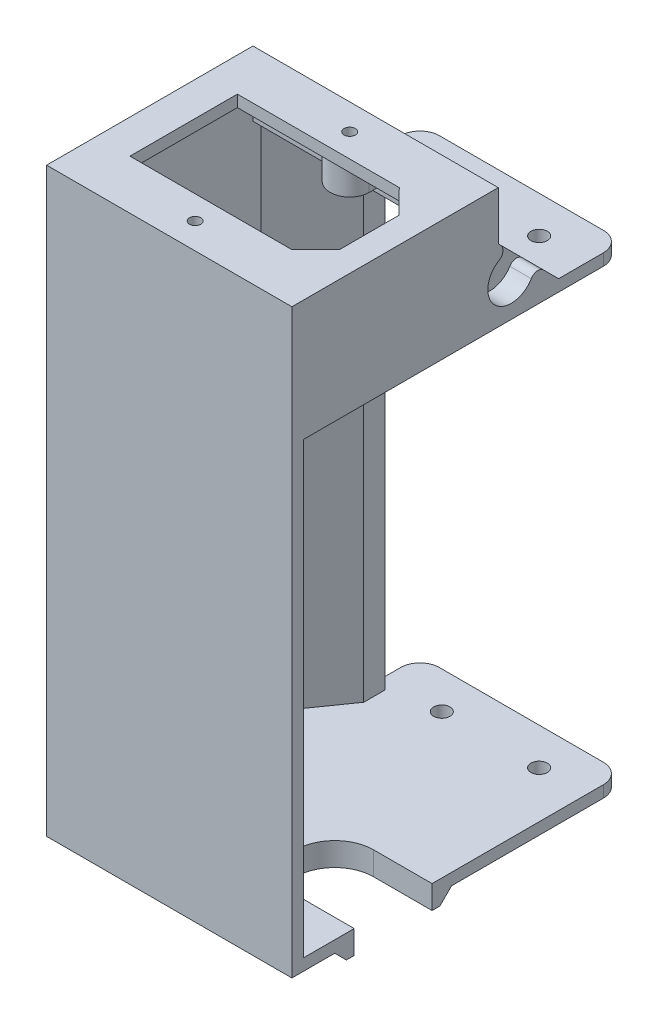
from build123d import *

# Parameters (mm, degrees)
SKETCH2_W           = 63
SKETCH2_H           = 53
BOSS_EXTRUDE1_DEPTH = 121.3
BOSS_EXTRUDE2_START = 121.3
SKETCH2_3_W         = 63
SKETCH2_3_H         = 53
BOSS_EXTRUDE2_DEPTH = 28
CHAMFER5_SIZE       = 15.5
SKETCH7_R           = 6
CUT_EXTRUDE3_DEPTH  = 5.5
FILLET5_R           = 2
SHELL2_START        = 3
SHELL2_DEPTH        = 115.3
SHELL2_START_2      = 134.895176786
SHELL2_2_DEPTH      = 11.404823214
SHELL2_START_3      = 118.3
SHELL2_3_DEPTH      = 0.6
SHELL2_START_4      = -35.5
SHELL2_4_DEPTH      = 51.5
SHELL2_START_5      = 16
SHELL2_5_DEPTH      = 8.5
SHELL2_START_6      = -25.165077586
SHELL2_6_DEPTH      = 3
SKETCH4_W           = 12
SKETCH4_H           = 115.3
CUT_EXTRUDE1_DEPTH  = 175.228269807
BOSS_EXTRUDE5_START = -3
BOSS_EXTRUDE5_DEPTH = 3
CUT_EXTRUDE2_REACH  = 168.939
SKETCH6_R           = 2.1
SKETCH8_R           = 1.45
CUT_EXTRUDE4_DEPTH  = 3
BOSS_EXTRUDE6_START = 8
SKETCH8_3_R         = 1.45
BOSS_EXTRUDE6_DEPTH = 8
CUT_EXTRUDE5_REACH  = 168.939
BOSS_EXTRUDE7_START = 3
BOSS_EXTRUDE7_DEPTH = 3
CHAMFER7_SIZE       = 3
FILLET6_R           = 5


with BuildPart() as part:
    # Sketch2 → Boss-Extrude1 (new body)
    with BuildSketch(Plane(origin=(0, 0, 0), x_dir=(1, 0, 0), z_dir=(0, 1, 0))):
        Polygon((24.5, -11), (24.5, 21), (-27.6, 21), (-27.6, 4.5), (-38.5, -11), align=None)
        with Locations((-7, -37.5)):
            Rectangle(SKETCH2_W, SKETCH2_H)
    extrude(amount=BOSS_EXTRUDE1_DEPTH)

    # Sketch2<3> → Boss-Extrude2 (add)
    with BuildSketch(Plane(origin=(0, 0, 0), x_dir=(1, 0, 0), z_dir=(0, 1, 0)).offset(BOSS_EXTRUDE2_START)):
        with Locations((-7, -37.5)):
            Rectangle(SKETCH2_3_W, SKETCH2_3_H)
    extrude(amount=BOSS_EXTRUDE2_DEPTH)

    # Chamfer5
    chamfer5_edges = [part.edges().sort_by_distance(p)[0] for p in [
        (-7, 121.3, 11),
    ]]
    chamfer(chamfer5_edges, length=CHAMFER5_SIZE)

    # Sketch7 → Cut-Extrude3 (cut)
    with BuildSketch(Plane(origin=(24.5, 0, 0), x_dir=(0, 0, -1), z_dir=(1, 0, 0))):
        with Locations((-7.675, 127.9)):
            Circle(SKETCH7_R)
    extrude(amount=-CUT_EXTRUDE3_DEPTH, mode=Mode.SUBTRACT)

    # Fillet5
    fillet5_edges = [part.edges().sort_by_distance(p)[0] for p in [
        (21.75, 133.885912692, 8.085912692),
        (21.75, 127.489087308, 1.689087308),
    ]]
    fillet(fillet5_edges, radius=FILLET5_R)

    # Shell2: read off the stored shape, not the designer's step
    # Shell2 outline → Shell2 (cut)
    with BuildSketch(Plane(origin=(0, 0, 0), x_dir=(1, 0, 0), z_dir=(0, 1, 0)).offset(SHELL2_START)):
        Polygon((-24.6, 3.550767359), (-35.5, -11.949232641), (-35.5, -61), (24.5, -61), (24.5, 18), (-24.6, 18), align=None)
    extrude(amount=SHELL2_DEPTH, mode=Mode.SUBTRACT)

    # Shell2 2 outline → Shell2 2 (cut)
    with BuildSketch(Plane(origin=(0, 0, 0), x_dir=(1, 0, 0), z_dir=(0, 1, 0)).offset(SHELL2_START_2)):
        Polygon((16, -14), (-35.5, -14), (-35.5, -61), (24.5, -61), (24.5, -14), align=None)
    extrude(amount=SHELL2_2_DEPTH, mode=Mode.SUBTRACT)

    # Shell2 3 outline → Shell2 3 (cut)
    with BuildSketch(Plane(origin=(0, 0, 0), x_dir=(1, 0, 0), z_dir=(0, 1, 0)).offset(SHELL2_START_3)):
        Polygon((16, -14), (-35.5, -14), (-35.5, -61), (24.5, -61), (24.5, -14), align=None)
    extrude(amount=SHELL2_3_DEPTH, mode=Mode.SUBTRACT)

    # Shell2 4 outline → Shell2 4 (cut)
    with BuildSketch(Plane.YZ.offset(SHELL2_START_4)):
        Polygon((134.895176786, 61), (118.9, 61), (118.9, 14), (118.3, 14), (118.3, -3.257359313), (135.557359313, 14), (134.895176786, 14), align=None)
    extrude(amount=SHELL2_4_DEPTH, mode=Mode.SUBTRACT)

    # Shell2 5 outline → Shell2 5 (cut)
    with BuildSketch(Plane.YZ.offset(SHELL2_START_5)):
        with BuildLine():
            Line((134.895176786, 61), (118.9, 61))
            Line((118.9, 61), (118.9, 14))
            Line((118.9, 14), (118.3, 14))
            Line((118.3, 14), (118.3, -3.257359313))
            Line((118.3, -3.257359313), (122.237182527, 0.679823214))
            ThreePointArc((122.237182527, 0.679823214), (121.536038969, 14.038961031), (134.895176786, 13.337817473))
            Line((134.895176786, 13.337817473), (135.557359313, 14))
            Line((135.557359313, 14), (134.895176786, 14))
            Line((134.895176786, 14), (134.895176786, 61))
        make_face()
    extrude(amount=SHELL2_5_DEPTH, mode=Mode.SUBTRACT)

    # Shell2 6 outline → Shell2 6 (add)
    with BuildSketch(Plane(origin=(0, 0, 0), x_dir=(0.5752319297142107, 0, -0.8179903587679168), z_dir=(0.8179903587679168, 0, 0.5752319297142109)).offset(SHELL2_START_6)):
        Polygon((-30.1950906, 3), (-11.246212005, 3), (-11.246212005, 118.3), (-11.604905776, 118.3), (-30.1950906, 133.506591954), align=None)
    extrude(amount=SHELL2_6_DEPTH)

    # Sketch4 → Cut-Extrude1 (cut, through all)
    with BuildSketch(Plane(origin=(24.5, 0, 0), x_dir=(0, 0, -1), z_dir=(1, 0, 0))):
        with Locations((15, 60.65)):
            Rectangle(SKETCH4_W, SKETCH4_H)
    extrude(amount=-CUT_EXTRUDE1_DEPTH, mode=Mode.SUBTRACT)

    # Sketch5 → Boss-Extrude5 (add)
    with BuildSketch(Plane(origin=(24.5, 0, 0), x_dir=(0, 0, -1), z_dir=(1, 0, 0)).offset(BOSS_EXTRUDE5_START)):
        with BuildLine():
            Line((3.257359313, 118.3), (-61, 118.3))
            Line((-61, 118.3), (-61, 146.3))
            Line((-61, 146.3), (-14, 146.3))
            Line((-14, 146.3), (-14, 135.557359313))
            Line((-14, 135.557359313), (-13.337817473, 134.895176786))
            ThreePointArc((-13.337817473, 134.895176786), (-14.038961031, 121.536038969), (-0.679823214, 122.237182527))
            Line((-0.679823214, 122.237182527), (3.257359313, 118.3))
        make_face()
    extrude(amount=BOSS_EXTRUDE5_DEPTH)

    # Cut-Extrude2: up to this face of the body (flat: up to its plane)
    cut_extrude2_end = Plane(part.part.faces().sort_by_distance((-1.55, 121.3, -12.75))[0])
    # Sketch6 → Cut-Extrude2 (cut, up to the picked face)
    with BuildSketch(Plane.XZ, mode=Mode.PRIVATE) as cut_extrude2_sk1:
        with Locations(Location((-12.5, -11.5, 0), (0, 0, 270))):
            Circle(SKETCH6_R)
    cut_extrude2_tool1 = split(extrude(cut_extrude2_sk1.sketch, amount=-CUT_EXTRUDE2_REACH, mode=Mode.PRIVATE), bisect_by=cut_extrude2_end, keep=Keep.BOTH, mode=Mode.PRIVATE)
    # Sketch6 → Cut-Extrude2 (cut, up to the picked face)
    with BuildSketch(Plane.XZ, mode=Mode.PRIVATE) as cut_extrude2_sk2:
        with Locations(Location((12.5, -11.5, 0), (0, 0, 270))):
            Circle(SKETCH6_R)
    cut_extrude2_tool2 = split(extrude(cut_extrude2_sk2.sketch, amount=-CUT_EXTRUDE2_REACH, mode=Mode.PRIVATE), bisect_by=cut_extrude2_end, keep=Keep.BOTH, mode=Mode.PRIVATE)
    add(cut_extrude2_tool1.solids().sort_by(Axis((-12.5, 0, -11.5), (0, 1, 0)))[0], mode=Mode.SUBTRACT)
    add(cut_extrude2_tool2.solids().sort_by(Axis((12.5, 0, -11.5), (0, 1, 0)))[0], mode=Mode.SUBTRACT)

    # Sketch8 → Cut-Extrude4 (cut)
    with BuildSketch(Plane.XZ.offset(-146.3)):
        Polygon((17.9, 45.123529412), (11.775, 51.3), (-29.8, 51.3), (-29.8, 23.7), (11.775, 23.7), (17.9, 29.876470588), align=None)
        with Locations(Location((-7, 17.65, 0), (0, 0, 270))):
            Circle(SKETCH8_R)
        with Locations(Location((-7, 57.35, 0), (0, 0, 270))):
            Circle(SKETCH8_R)
    extrude(amount=-CUT_EXTRUDE4_DEPTH, mode=Mode.SUBTRACT)

    # Sketch8<3> → Boss-Extrude6 (add)
    # profile 1 of 2: a face of its own
    with BuildSketch(Plane.XZ.offset(-146.3).offset(BOSS_EXTRUDE6_START)):
        with BuildLine():
            Line((-12, 61), (-12, 57.35))
            ThreePointArc((-12, 57.35), (-7, 52.35), (-2, 57.35))
            Line((-2, 57.35), (-2, 61))
            Line((-2, 61), (-12, 61))
        make_face()
        with Locations(Location((-7, 57.35, 0), (0, 0, 270))):
            Circle(SKETCH8_3_R, mode=Mode.SUBTRACT)
    # profile 2 of 2: a face of its own
    with BuildSketch(Plane.XZ.offset(-146.3).offset(BOSS_EXTRUDE6_START)):
        with BuildLine():
            ThreePointArc((-2, 17.65), (-7, 22.65), (-12, 17.65))
            Line((-12, 17.65), (-12, 14))
            Line((-12, 14), (-2, 14))
            Line((-2, 14), (-2, 17.65))
        make_face()
        with Locations(Location((-7, 17.65, 0), (0, 0, 270))):
            Circle(SKETCH8_3_R, mode=Mode.SUBTRACT)
    extrude(amount=-BOSS_EXTRUDE6_DEPTH)

    # Sketch9 → Cut-Extrude5 (cut, up to next)
    with BuildSketch(Plane.XZ, mode=Mode.PRIVATE) as cut_extrude5_sk1:
        with BuildLine():
            Line((24.5, 48), (9.5, 48))
            ThreePointArc((9.5, 48), (-0.5, 38), (9.5, 28))
            Line((9.5, 28), (24.5, 28))
            Line((24.5, 28), (24.5, 48))
        make_face()
    cut_extrude5_tool1 = extrude(cut_extrude5_sk1.sketch, amount=-CUT_EXTRUDE5_REACH, mode=Mode.PRIVATE) & part.part
    add(cut_extrude5_tool1.solids().sort_by_distance((12.964021, 0, 38))[0], mode=Mode.SUBTRACT)

    # Sketch9<4> → Boss-Extrude7 (add)
    with BuildSketch(Plane.XZ.offset(BOSS_EXTRUDE7_START)):
        with BuildLine():
            ThreePointArc((9.5, 28), (-0.5, 38), (9.5, 48))
            Line((9.5, 48), (24.5, 48))
            Line((24.5, 48), (24.5, 50))
            Line((24.5, 50), (9.5, 50))
            ThreePointArc((9.5, 50), (-2.5, 38), (9.5, 26))
            Line((9.5, 26), (24.5, 26))
            Line((24.5, 26), (24.5, 28))
            Line((24.5, 28), (9.5, 28))
        make_face()
    extrude(amount=-BOSS_EXTRUDE7_DEPTH)

    # Chamfer7
    chamfer7_edges = [part.edges().sort_by_distance(p)[0] for p in [
        (17, 0, 26),
        (-2.5, 0, 38),
        (17, 0, 50),
    ]]
    chamfer(chamfer7_edges, length=CHAMFER7_SIZE - 0.0001)  # a hair under: the kernel refuses the full size

    # Fillet6
    fillet6_edges = [part.edges().sort_by_distance(p)[0] for p in [
        (-27.6, 1.5, -21),
        (24.5, 1.5, -21),
        (-27.6, 119.8, -21),
        (24.5, 119.8, -21),
    ]]
    fillet(fillet6_edges, radius=FILLET6_R)


solid = part.part
